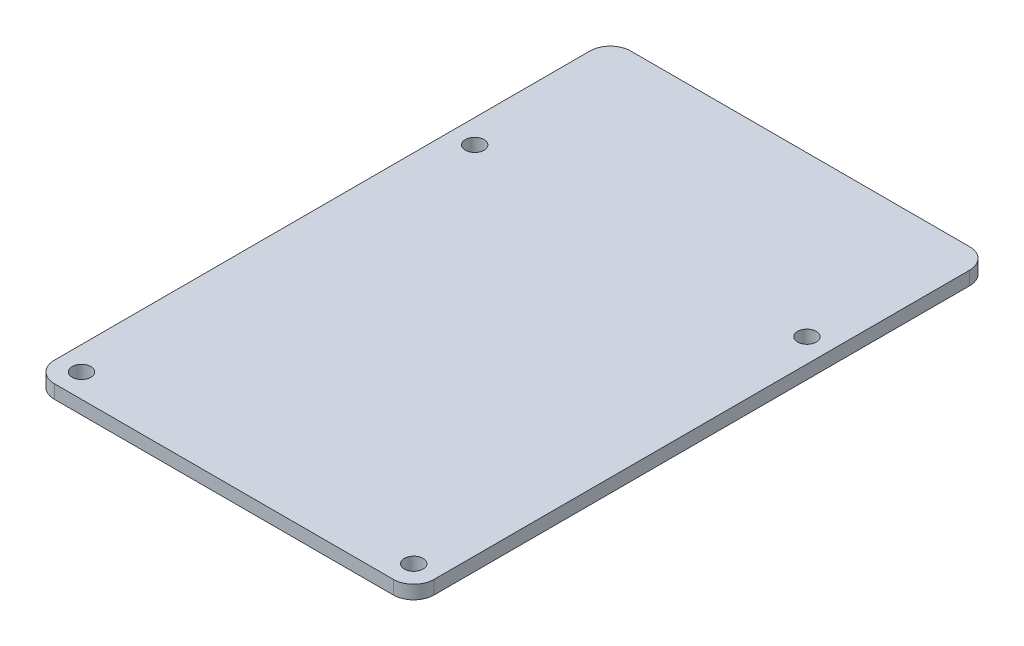
from build123d import *

# Parameters (mm, degrees)
SKETCH1_W           = 56
SKETCH1_H           = 85
SKETCH1_R           = 1.375
BOSS_EXTRUDE1_DEPTH = 2
FILLET1_R           = 3


with BuildPart() as part:
    # Sketch1 → Boss-Extrude1 (new body)
    with BuildSketch(Plane(origin=(0, 0, 0), x_dir=(1, 0, 0), z_dir=(0, 1, 0))):
        Rectangle(SKETCH1_W, SKETCH1_H)
        with Locations((-24.5, -39)):
            Circle(SKETCH1_R, mode=Mode.SUBTRACT)
        with Locations((-24.5, 19)):
            Circle(SKETCH1_R, mode=Mode.SUBTRACT)
        with Locations((24.5, 19)):
            Circle(SKETCH1_R, mode=Mode.SUBTRACT)
        with Locations((24.5, -39)):
            Circle(SKETCH1_R, mode=Mode.SUBTRACT)
    extrude(amount=BOSS_EXTRUDE1_DEPTH)

    # Fillet1
    fillet1_edges = [part.edges().sort_by_distance(p)[0] for p in [
        (-28, 1, -42.5),
        (28, 1, -42.5),
        (28, 1, 42.5),
        (-28, 1, 42.5),
    ]]
    fillet(fillet1_edges, radius=FILLET1_R)


solid = part.part
